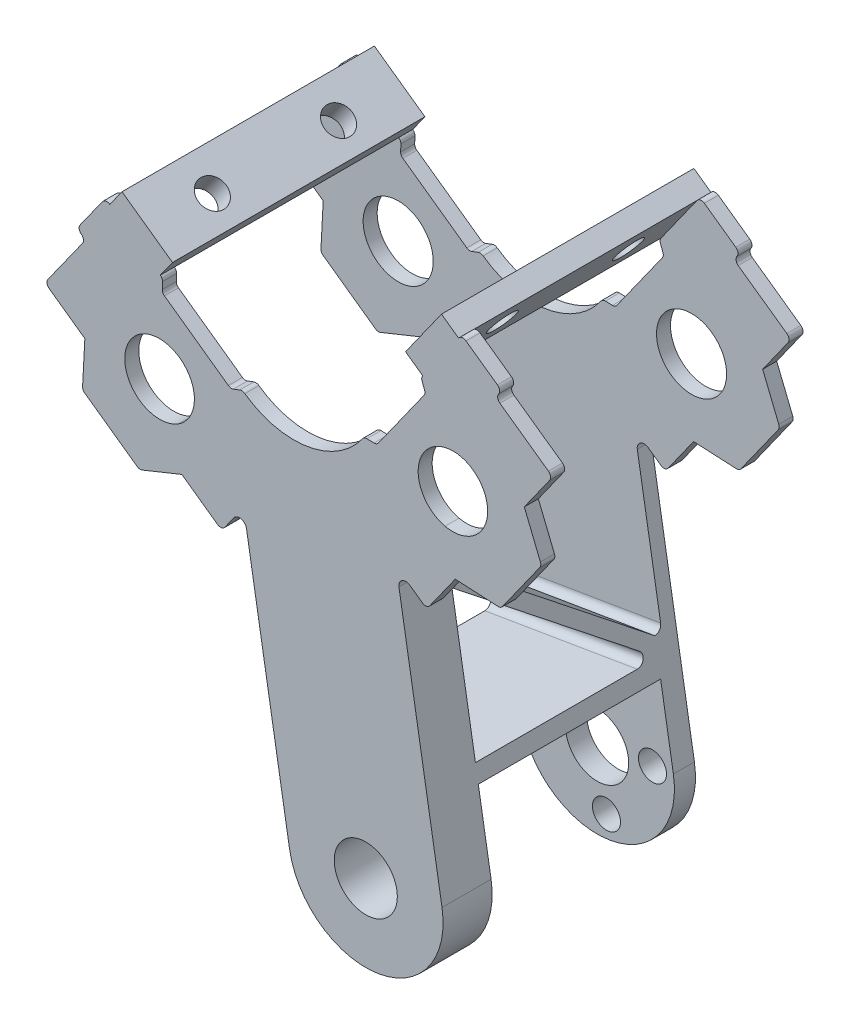
from build123d import *

# Parameters (mm, degrees)
SKETCH_2_R           = 73.899050909
EXTRUDE_2_DEPTH      = 3
SKETCH_6_OUTSIDE_W   = 191.606
SKETCH_6_OUTSIDE_H   = 191.606
CUT_EXTRUDE_4_DEPTH  = 10
SKETCH_7_R           = 4.5
SKETCH_7_R_2         = 2
CUT_EXTRUDE_5_DEPTH  = 10
SKETCH_8_R           = 5
CUT_EXTRUDE_6_DEPTH  = 10
SKETCH_9_W           = 6.25
SKETCH_9_H           = 33
SKETCH_9_R           = 2
EXTRUDE_3_DEPTH      = 20
SKETCH_10_W          = 6.25
SKETCH_10_H          = 30
CUT_EXTRUDE_7_DEPTH  = 17
SKETCH_11_W          = 1.5
SKETCH_11_H          = 33
SKETCH_11_W_2        = 1.098612182
EXTRUDE_4_DEPTH      = 3
SKETCH_13_R          = 2
SKETCH_13_R_2        = 4.5
SKETCH_13_R_3        = 5
EXTRUDE_7_DEPTH      = 3
EXTRUDE_8_DEPTH      = 4
SKETCH_19_W          = 26
SKETCH_19_H          = 2.5
EXTRUDE_10_DEPTH     = 22.051538
CUT_EXTRUDE_8_DEPTH  = 72.494882875
SKETCH_21_R          = 4.5
CUT_EXTRUDE_9_DEPTH  = 68.464062675
SKETCH_22_R          = 4.5
EXTRUDE_12_DEPTH     = 7
CUT_EXTRUDE_START    = -1
CUT_EXTRUDE_10_DEPTH = 1
CUT_EXTRUDE_11_DEPTH = 1
FILLET_1_R           = 1
FILLET_2_R           = 1
FILLET_3_R           = 1
FILLET_4_R           = 1
FILLET_5_R           = 1
FILLET_12_R          = 1


# Some blends are built 0.0001 mm under size
with BuildPart() as part:
    # 草图2 → 凸台-拉伸2 (new body)
    with BuildSketch(Plane.XY):
        Circle(SKETCH_2_R)
    extrude(amount=EXTRUDE_2_DEPTH)

    # 草图6 outside → 切除-拉伸4 (cut)
    with BuildSketch(Plane.XY.offset(3)):
        Rectangle(SKETCH_6_OUTSIDE_W, SKETCH_6_OUTSIDE_H)
        with BuildLine():
            Line((-31.535008434, 35.392907634), (-24.330725879, 30.255179498))
            ThreePointArc((-24.330725879, 30.255179498), (-24.094123176, 29.977447186), (-24.016566775, 29.6209348))
            Line((-24.016566775, 29.6209348), (-24.048055472, 28.621430692))
            ThreePointArc((-24.048055472, 28.621430692), (-23.970499071, 28.264918306), (-23.733896368, 27.987185994))
            Line((-23.733896368, 27.987185994), (-14.617442117, 21.485794197))
            ThreePointArc((-14.617442117, 21.485794197), (-14.277785331, 21.352567532), (-13.915454513, 21.395374713))
            Line((-13.915454513, 21.395374713), (-12.980724299, 21.750732881))
            ThreePointArc((-12.980724299, 21.750732881), (-12.618393481, 21.793540061), (-12.278736695, 21.660313397))
            ThreePointArc((-12.278736695, 21.660313397), (-3.294948021, 19.590594088), (4.517495731, 24.485276874))
            ThreePointArc((4.517495731, 24.485276874), (4.794882728, 24.722284322), (5.15128164, 24.800360515))
            Line((5.15128164, 24.800360515), (6.150830603, 24.770329354))
            ThreePointArc((6.150830603, 24.770329354), (6.507229515, 24.848405547), (6.784616512, 25.085412994))
            Line((6.784616512, 25.085412994), (13.272707556, 34.211338045))
            ThreePointArc((13.272707556, 34.211338045), (13.405438783, 34.551188744), (13.362103288, 34.913456755))
            Line((13.362103288, 34.913456755), (13.005382451, 35.847667782))
            ThreePointArc((13.005382451, 35.847667782), (12.962046956, 36.209935793), (13.094778183, 36.549786492))
            Line((13.094778183, 36.549786492), (18.221995392, 43.761553351))
            ThreePointArc((18.221995392, 43.761553351), (18.708323153, 44.066496264), (19.267836012, 43.938237808))
            Line((19.267836012, 43.938237808), (23.750427961, 40.751331876))
            ThreePointArc((23.750427961, 40.751331876), (24.055370874, 40.265004115), (23.927112418, 39.705491256))
            ThreePointArc((23.927112418, 39.705491256), (23.798853962, 39.145978396), (24.103796875, 38.659650636))
            Line((24.103796875, 38.659650636), (31.031438978, 33.734432377))
            ThreePointArc((31.031438978, 33.734432377), (31.336381891, 33.248104616), (31.208123435, 32.688591757))
            Line((31.208123435, 32.688591757), (27.586639421, 27.59473727))
            Line((27.586639421, 27.59473727), (29.886186599, 21.936685188))
            ThreePointArc((29.886186599, 21.936685188), (29.936337177, 21.567492307), (29.80264047, 21.219722765))
            Line((29.80264047, 21.219722765), (24.485385754, 13.740655704))
            ThreePointArc((24.485385754, 13.740655704), (24.200836556, 13.500134983), (23.835658301, 13.426220802))
            Line((23.835658301, 13.426220802), (17.736202905, 13.739453063))
            Line((17.736202905, 13.739453063), (14.114718892, 8.645598576))
            ThreePointArc((14.114718892, 8.645598576), (13.628391131, 8.340655663), (13.068878271, 8.468914119))
            Line((13.068878271, 8.468914119), (9.306333892, 11.143901076))
            Line((9.306333892, 11.143901076), (15.851133659, -27.769160612))
            ThreePointArc((15.851133659, -27.769160612), (6.806822505, -40.470956104), (-5.894972987, -31.42664495))
            Line((-5.894972987, -31.42664495), (-12.439772753, 7.486416738))
            Line((-12.439772753, 7.486416738), (-15.120243503, 3.727777092))
            ThreePointArc((-15.120243503, 3.727777092), (-15.607015422, 3.423543678), (-16.166340657, 3.552617894))
            Line((-16.166340657, 3.552617894), (-21.25490879, 7.181526042))
            Line((-21.25490879, 7.181526042), (-26.916308113, 4.890232022))
            ThreePointArc((-26.916308113, 4.890232022), (-27.285573732, 4.840619864), (-27.633147944, 4.974823555))
            Line((-27.633147944, 4.974823555), (-35.1044533, 10.30297878))
            ThreePointArc((-35.1044533, 10.30297878), (-35.344558829, 10.587878409), (-35.41794042, 10.953164059))
            Line((-35.41794042, 10.953164059), (-35.095814113, 17.052156207))
            Line((-35.095814113, 17.052156207), (-40.184382246, 20.681064356))
            ThreePointArc((-40.184382246, 20.681064356), (-40.48861566, 21.167836275), (-40.359541444, 21.727161509))
            Line((-40.359541444, 21.727161509), (-35.424226362, 28.647614171))
            ThreePointArc((-35.424226362, 28.647614171), (-35.295152147, 29.206939406), (-35.59938556, 29.693711325))
            ThreePointArc((-35.59938556, 29.693711325), (-35.903618974, 30.180483244), (-35.774544759, 30.739808479))
            Line((-35.774544759, 30.739808479), (-32.581105588, 35.217748436))
            ThreePointArc((-32.581105588, 35.217748436), (-32.094333668, 35.521981849), (-31.535008434, 35.392907634))
        make_face(mode=Mode.SUBTRACT)
    extrude(amount=-CUT_EXTRUDE_4_DEPTH, mode=Mode.SUBTRACT)

    # 草图7 → 切除-拉伸5 (cut)
    with BuildSketch(Plane.XY.offset(3)):
        with Locations((4.978080336, -29.597902781)):
            Circle(SKETCH_7_R)
        with Locations((3.651194467, -21.708709293)):
            Circle(SKETCH_7_R_2)
        with Locations((12.867273824, -28.271016911)):
            Circle(SKETCH_7_R_2)
        with Locations((6.304966206, -37.487096269)):
            Circle(SKETCH_7_R_2)
        with Locations((-2.911113152, -30.924788651)):
            Circle(SKETCH_7_R_2)
    extrude(amount=-CUT_EXTRUDE_5_DEPTH, mode=Mode.SUBTRACT)

    # 草图8 → 切除-拉伸6 (cut)
    with BuildSketch(Plane.XY.offset(3)):
        with Locations((-24.401296977, 17.408951983)):
            Circle(SKETCH_8_R)
        with Locations((17.442589177, 24.41531991)):
            Circle(SKETCH_8_R)
    extrude(amount=-CUT_EXTRUDE_6_DEPTH, mode=Mode.SUBTRACT)

    # 镜向3: part across plane


with BuildPart() as part_1:
    add(part.part)
    add(part.part.mirror(Plane(origin=(0, 0, 0), x_dir=(0, 0, 1), z_dir=(-0.9861491859840638, -0.16586073369839163, 0))))

    # 草图9 → 凸台-拉伸3 (add)
    with BuildSketch(Plane(origin=(-3.770666854, -5.287346609, 0), x_dir=(0.814170901346189, -0.5806253037899178, 0), z_dir=(-0.5806253037899178, -0.814170901346189, 0))):
        with Locations((-41.599903988, -13.5)):
            Rectangle(SKETCH_9_W, SKETCH_9_H)
        with Locations(Location((-41.452827346, -24, 0), (0, 0, 180))):
            Circle(SKETCH_9_R, mode=Mode.SUBTRACT)
        with Locations(Location((-41.452827346, -6, 0), (0, 0, 180))):
            Circle(SKETCH_9_R, mode=Mode.SUBTRACT)
    extrude(amount=-EXTRUDE_3_DEPTH)

    # 草图10 → 切除-拉伸7 (cut)
    with BuildSketch(Plane(origin=(-3.770666854, -5.287346609, 0), x_dir=(0.8141709013461893, -0.5806253037899172, 0), z_dir=(-0.5806253037899172, -0.8141709013461893, 0))):
        with Locations((-41.599903988, -15)):
            Rectangle(SKETCH_10_W, SKETCH_10_H)
    extrude(amount=-CUT_EXTRUDE_7_DEPTH, mode=Mode.SUBTRACT)

    # 草图11 → 凸台-拉伸4 (add)
    with BuildSketch(Plane(origin=(6.09996331, 8.553558714, 0), x_dir=(0.8141709013461892, -0.5806253037899176, 0), z_dir=(0.5806253037899175, 0.8141709013461891, 0))):
        with Locations((-45.474903988, 13.5)):
            Rectangle(SKETCH_11_W, SKETCH_11_H)
        with Locations((-37.925597897, 13.5)):
            Rectangle(SKETCH_11_W_2, SKETCH_11_H)
    extrude(amount=EXTRUDE_4_DEPTH)

    # 镜向4: part across plane


with BuildPart() as part_2:
    add(part_1.part)
    add(part_1.part.mirror(Plane(origin=(0, 0, 0), x_dir=(0, 0, 1), z_dir=(-0.9861491859840638, -0.16586073369839163, 0))))

    # 草图13 → 凸台-拉伸7 (add)
    # profile 1 of 3: a face of its own
    with BuildSketch(Plane(origin=(0, 0, -30), x_dir=(-1, 0, 0), z_dir=(0, 0, -1))):
        Polygon((-15.776945238, 45.499865677), (-18.221995392, 43.761553351), (-13.094778183, 36.549786492), (-10.649728029, 38.288098818), align=None)
    # profile 2 of 3: a face of its own
    with BuildSketch(Plane(origin=(0, 0, -30), x_dir=(-1, 0, 0), z_dir=(0, 0, -1))):
        with BuildLine():
            Line((-13.094778183, 36.549786492), (-18.221995392, 43.761553351))
            ThreePointArc((-18.221995392, 43.761553351), (-18.708323153, 44.066496264), (-19.267836012, 43.938237808))
            Line((-19.267836012, 43.938237808), (-23.750427961, 40.751331876))
            ThreePointArc((-23.750427961, 40.751331876), (-24.055370874, 40.265004115), (-23.927112418, 39.705491256))
            ThreePointArc((-23.927112418, 39.705491256), (-23.798853962, 39.145978396), (-24.103796875, 38.659650636))
            Line((-24.103796875, 38.659650636), (-31.031438978, 33.734432377))
            ThreePointArc((-31.031438978, 33.734432377), (-31.336381891, 33.248104616), (-31.208123435, 32.688591757))
            Line((-31.208123435, 32.688591757), (-27.586639421, 27.59473727))
            Line((-27.586639421, 27.59473727), (-29.886186599, 21.936685188))
            ThreePointArc((-29.886186599, 21.936685188), (-29.936337177, 21.567492307), (-29.80264047, 21.219722765))
            Line((-29.80264047, 21.219722765), (-24.485385754, 13.740655704))
            ThreePointArc((-24.485385754, 13.740655704), (-24.200836556, 13.500134983), (-23.835658301, 13.426220802))
            Line((-23.835658301, 13.426220802), (-17.736202905, 13.739453063))
            Line((-17.736202905, 13.739453063), (-14.114718892, 8.645598576))
            ThreePointArc((-14.114718892, 8.645598576), (-13.628391131, 8.340655663), (-13.068878271, 8.468914119))
            Line((-13.068878271, 8.468914119), (-9.306333892, 11.143901076))
            Line((-9.306333892, 11.143901076), (-15.851133659, -27.769160612))
            ThreePointArc((-15.851133659, -27.769160612), (-6.806822505, -40.470956104), (5.894972987, -31.42664495))
            Line((5.894972987, -31.42664495), (12.439772753, 7.486416738))
            Line((12.439772753, 7.486416738), (15.120243503, 3.727777092))
            ThreePointArc((15.120243503, 3.727777092), (15.607015422, 3.423543678), (16.166340657, 3.552617894))
            Line((16.166340657, 3.552617894), (21.25490879, 7.181526042))
            Line((21.25490879, 7.181526042), (26.916308113, 4.890232022))
            ThreePointArc((26.916308113, 4.890232022), (27.285573732, 4.840619864), (27.633147944, 4.974823555))
            Line((27.633147944, 4.974823555), (35.1044533, 10.30297878))
            ThreePointArc((35.1044533, 10.30297878), (35.344558829, 10.587878409), (35.41794042, 10.953164059))
            Line((35.41794042, 10.953164059), (35.095814113, 17.052156207))
            Line((35.095814113, 17.052156207), (40.184382246, 20.681064356))
            ThreePointArc((40.184382246, 20.681064356), (40.48861566, 21.167836275), (40.359541444, 21.727161509))
            Line((40.359541444, 21.727161509), (35.424226362, 28.647614171))
            ThreePointArc((35.424226362, 28.647614171), (35.295152147, 29.206939406), (35.59938556, 29.693711325))
            ThreePointArc((35.59938556, 29.693711325), (35.903618974, 30.180483244), (35.774544759, 30.739808479))
            Line((35.774544759, 30.739808479), (32.581105588, 35.217748436))
            ThreePointArc((32.581105588, 35.217748436), (32.094333668, 35.521981849), (31.535008434, 35.392907634))
            Line((31.535008434, 35.392907634), (24.330725879, 30.255179498))
            ThreePointArc((24.330725879, 30.255179498), (24.094123176, 29.977447186), (24.016566775, 29.6209348))
            Line((24.016566775, 29.6209348), (24.048055472, 28.621430692))
            ThreePointArc((24.048055472, 28.621430692), (23.970499071, 28.264918306), (23.733896368, 27.987185994))
            Line((23.733896368, 27.987185994), (14.617442117, 21.485794197))
            ThreePointArc((14.617442117, 21.485794197), (14.277785331, 21.352567532), (13.915454513, 21.395374713))
            Line((13.915454513, 21.395374713), (12.980724299, 21.750732881))
            ThreePointArc((12.980724299, 21.750732881), (12.618393481, 21.793540061), (12.278736695, 21.660313397))
            ThreePointArc((12.278736695, 21.660313397), (3.294948021, 19.590594088), (-4.517495731, 24.485276874))
            ThreePointArc((-4.517495731, 24.485276874), (-4.794882728, 24.722284322), (-5.15128164, 24.800360515))
            Line((-5.15128164, 24.800360515), (-6.150830603, 24.770329354))
            ThreePointArc((-6.150830603, 24.770329354), (-6.507229515, 24.848405547), (-6.784616512, 25.085412994))
            Line((-6.784616512, 25.085412994), (-13.272707556, 34.211338045))
            ThreePointArc((-13.272707556, 34.211338045), (-13.405438783, 34.551188744), (-13.362103288, 34.913456755))
            Line((-13.362103288, 34.913456755), (-13.005382451, 35.847667782))
            ThreePointArc((-13.005382451, 35.847667782), (-12.962046956, 36.209935793), (-13.094778183, 36.549786492))
        make_face()
        with Locations(Location((-6.304966206, -37.487096269, 0), (0, 0, 180))):
            Circle(SKETCH_13_R, mode=Mode.SUBTRACT)
        with Locations(Location((2.911113152, -30.924788651, 0), (0, 0, 180))):
            Circle(SKETCH_13_R, mode=Mode.SUBTRACT)
        with Locations(Location((-12.867273824, -28.271016911, 0), (0, 0, 180))):
            Circle(SKETCH_13_R, mode=Mode.SUBTRACT)
        with Locations(Location((-4.978080336, -29.597902781, 0), (0, 0, 180))):
            Circle(SKETCH_13_R_2, mode=Mode.SUBTRACT)
        with Locations(Location((-3.651194467, -21.708709293, 0), (0, 0, 180))):
            Circle(SKETCH_13_R, mode=Mode.SUBTRACT)
        with Locations((-17.442589177, 24.41531991)):
            Circle(SKETCH_13_R_3, mode=Mode.SUBTRACT)
        with Locations((24.401296977, 17.408951983)):
            Circle(SKETCH_13_R_3, mode=Mode.SUBTRACT)
    # profile 3 of 3: a face of its own
    with BuildSketch(Plane(origin=(0, 0, -30), x_dir=(-1, 0, 0), z_dir=(0, 0, -1))):
        Polygon((22.588849967, 32.697692202), (24.330725879, 30.255179498), (31.535008434, 35.392907634), (29.793132522, 37.835420338), align=None)
    extrude(amount=EXTRUDE_7_DEPTH)

    # 草图15 → 凸台-拉伸8 (add)
    with BuildSketch(Plane(origin=(0, 0, 0), x_dir=(-1, 0, 0), z_dir=(0, 0, -1))):
        with BuildLine():
            Line((-9.306333892, 11.143901076), (-15.851133659, -27.769160612))
            ThreePointArc((-15.851133659, -27.769160612), (-6.806822505, -40.470956104), (5.894972987, -31.42664495))
            Line((5.894972987, -31.42664495), (12.439772753, 7.486416738))
            Line((12.439772753, 7.486416738), (-9.306333892, 11.143901076))
        make_face()
    extrude(amount=EXTRUDE_8_DEPTH)

    # 草图19 → 凸台-拉伸10 (add)
    with BuildSketch(Plane(origin=(-10.873053323, -1.828742169, 0), x_dir=(0, 0, 1), z_dir=(-0.9861491859840638, -0.16586073369839163, 0))):
        Polygon((-30, -14.039384993), (-30, -16.539384993), (-4, 3.661315578), (-4, 6.161315578), align=None)
        with Locations((-17, -17.789384993)):
            Rectangle(SKETCH_19_W, SKETCH_19_H)
    extrude(amount=-EXTRUDE_10_DEPTH)

    # 草图20 → 切除-拉伸8 (cut, through all)
    with BuildSketch(Plane(origin=(-10.873053323, -1.828742169, 0), x_dir=(0, 0, 1), z_dir=(-0.9861491859840638, -0.16586073369839163, 0))):
        Polygon((-4, 6.161315578), (0, 9.445993608), (-4, 9.445993608), align=None)
    extrude(amount=-CUT_EXTRUDE_8_DEPTH, mode=Mode.SUBTRACT)

    # 草图21 → 切除-拉伸9 (cut, through all)
    with BuildSketch(Plane(origin=(0, 0, -4), x_dir=(-1, 0, 0), z_dir=(0, 0, -1))):
        with Locations(Location((-4.978080336, -29.597902781, 0), (0, 0, 180))):
            Circle(SKETCH_21_R)
    extrude(amount=-CUT_EXTRUDE_9_DEPTH, mode=Mode.SUBTRACT)

    # 草图22 → 凸台-拉伸12 (add, through all)
    with BuildSketch(Plane(origin=(0, 0, -4), x_dir=(-1, 0, 0), z_dir=(0, 0, -1))):
        with BuildLine():
            Line((-14.030939687, -16.946931843), (-15.851133659, -27.769160612))
            ThreePointArc((-15.851133659, -27.769160612), (-6.806822505, -40.470956104), (5.894972987, -31.42664495))
            Line((5.894972987, -31.42664495), (7.715166959, -20.604416181))
            Line((7.715166959, -20.604416181), (-14.030939687, -16.946931843))
        make_face()
        with Locations(Location((-4.978080336, -29.597902781, 0), (0, 0, 180))):
            Circle(SKETCH_22_R, mode=Mode.SUBTRACT)
    extrude(amount=-EXTRUDE_12_DEPTH)

    # 草图23 → 切除-拉伸10 (cut)
    with BuildSketch(Plane(origin=(0, 0, 0), x_dir=(-1, 0, 0), z_dir=(0, 0, -1)).offset(CUT_EXTRUDE_START)):
        with BuildLine():
            Line((-23.835658301, 13.426220802), (-17.736202905, 13.739453063))
            Line((-17.736202905, 13.739453063), (-14.114718892, 8.645598576))
            ThreePointArc((-14.114718892, 8.645598576), (-13.628391131, 8.340655663), (-13.068878271, 8.468914119))
            Line((-13.068878271, 8.468914119), (-9.306333892, 11.143901076))
            Line((-9.306333892, 11.143901076), (12.439772753, 7.486416738))
            Line((12.439772753, 7.486416738), (15.120243503, 3.727777092))
            ThreePointArc((15.120243503, 3.727777092), (15.607015422, 3.423543678), (16.166340657, 3.552617894))
            Line((16.166340657, 3.552617894), (21.25490879, 7.181526042))
            Line((21.25490879, 7.181526042), (26.916308113, 4.890232022))
            ThreePointArc((26.916308113, 4.890232022), (27.285573732, 4.840619864), (27.633147944, 4.974823555))
            Line((27.633147944, 4.974823555), (35.1044533, 10.30297878))
            ThreePointArc((35.1044533, 10.30297878), (35.344558829, 10.587878409), (35.41794042, 10.953164059))
            Line((35.41794042, 10.953164059), (35.095814113, 17.052156207))
            Line((35.095814113, 17.052156207), (40.184382246, 20.681064356))
            ThreePointArc((40.184382246, 20.681064356), (40.48861566, 21.167836275), (40.359541444, 21.727161509))
            Line((40.359541444, 21.727161509), (35.424226362, 28.647614171))
            ThreePointArc((35.424226362, 28.647614171), (35.295152147, 29.206939406), (35.59938556, 29.693711325))
            ThreePointArc((35.59938556, 29.693711325), (35.903618974, 30.180483244), (35.774544759, 30.739808479))
            Line((35.774544759, 30.739808479), (32.581105588, 35.217748436))
            ThreePointArc((32.581105588, 35.217748436), (32.094333668, 35.521981849), (31.535008434, 35.392907634))
            Line((31.535008434, 35.392907634), (24.330725879, 30.255179498))
            ThreePointArc((24.330725879, 30.255179498), (24.094123176, 29.977447186), (24.016566775, 29.6209348))
            Line((24.016566775, 29.6209348), (24.048055472, 28.621430692))
            ThreePointArc((24.048055472, 28.621430692), (23.970499071, 28.264918306), (23.733896368, 27.987185994))
            Line((23.733896368, 27.987185994), (14.617442117, 21.485794197))
            ThreePointArc((14.617442117, 21.485794197), (14.277785331, 21.352567532), (13.915454513, 21.395374713))
            Line((13.915454513, 21.395374713), (12.980724299, 21.750732881))
            ThreePointArc((12.980724299, 21.750732881), (12.618393481, 21.793540061), (12.278736695, 21.660313397))
            ThreePointArc((12.278736695, 21.660313397), (3.294948021, 19.590594088), (-4.517495731, 24.485276874))
            ThreePointArc((-4.517495731, 24.485276874), (-4.794882728, 24.722284322), (-5.15128164, 24.800360515))
            Line((-5.15128164, 24.800360515), (-6.150830603, 24.770329354))
            ThreePointArc((-6.150830603, 24.770329354), (-6.507229515, 24.848405547), (-6.784616512, 25.085412994))
            Line((-6.784616512, 25.085412994), (-13.272707556, 34.211338045))
            ThreePointArc((-13.272707556, 34.211338045), (-13.405438783, 34.551188744), (-13.362103288, 34.913456755))
            Line((-13.362103288, 34.913456755), (-13.005382451, 35.847667782))
            ThreePointArc((-13.005382451, 35.847667782), (-12.962046956, 36.209935793), (-13.094778183, 36.549786492))
            Line((-13.094778183, 36.549786492), (-18.221995392, 43.761553351))
            ThreePointArc((-18.221995392, 43.761553351), (-18.708323153, 44.066496264), (-19.267836012, 43.938237808))
            Line((-19.267836012, 43.938237808), (-23.750427961, 40.751331876))
            ThreePointArc((-23.750427961, 40.751331876), (-24.055370874, 40.265004115), (-23.927112418, 39.705491256))
            ThreePointArc((-23.927112418, 39.705491256), (-23.798853962, 39.145978396), (-24.103796875, 38.659650636))
            Line((-24.103796875, 38.659650636), (-31.031438978, 33.734432377))
            ThreePointArc((-31.031438978, 33.734432377), (-31.336381891, 33.248104616), (-31.208123435, 32.688591757))
            Line((-31.208123435, 32.688591757), (-27.586639421, 27.59473727))
            Line((-27.586639421, 27.59473727), (-29.886186599, 21.936685188))
            ThreePointArc((-29.886186599, 21.936685188), (-29.936337177, 21.567492307), (-29.80264047, 21.219722765))
            Line((-29.80264047, 21.219722765), (-24.485385754, 13.740655704))
            ThreePointArc((-24.485385754, 13.740655704), (-24.200836556, 13.500134983), (-23.835658301, 13.426220802))
        make_face()
    extrude(amount=CUT_EXTRUDE_10_DEPTH, mode=Mode.SUBTRACT)

    # 草图24 → 切除-拉伸11 (cut)
    with BuildSketch(Plane.XY.offset(-30)):
        with BuildLine():
            Line((-8.544470627, -15.673670252), (13.201636018, -12.016185913))
            Line((13.201636018, -12.016185913), (9.306333892, 11.143901076))
            Line((9.306333892, 11.143901076), (13.068878271, 8.468914119))
            ThreePointArc((13.068878271, 8.468914119), (13.628391131, 8.340655663), (14.114718892, 8.645598576))
            Line((14.114718892, 8.645598576), (17.736202905, 13.739453063))
            Line((17.736202905, 13.739453063), (23.835658301, 13.426220802))
            ThreePointArc((23.835658301, 13.426220802), (24.200836556, 13.500134983), (24.485385754, 13.740655704))
            Line((24.485385754, 13.740655704), (29.80264047, 21.219722765))
            ThreePointArc((29.80264047, 21.219722765), (29.936337177, 21.567492307), (29.886186599, 21.936685188))
            Line((29.886186599, 21.936685188), (27.586639421, 27.59473727))
            Line((27.586639421, 27.59473727), (31.208123435, 32.688591757))
            ThreePointArc((31.208123435, 32.688591757), (31.336381891, 33.248104616), (31.031438978, 33.734432377))
            Line((31.031438978, 33.734432377), (24.103796875, 38.659650636))
            ThreePointArc((24.103796875, 38.659650636), (23.798853962, 39.145978396), (23.927112418, 39.705491256))
            ThreePointArc((23.927112418, 39.705491256), (24.055370874, 40.265004115), (23.750427961, 40.751331876))
            Line((23.750427961, 40.751331876), (19.267836012, 43.938237808))
            ThreePointArc((19.267836012, 43.938237808), (18.708323153, 44.066496264), (18.221995392, 43.761553351))
            Line((18.221995392, 43.761553351), (13.094778183, 36.549786492))
            ThreePointArc((13.094778183, 36.549786492), (12.962046956, 36.209935793), (13.005382451, 35.847667782))
            Line((13.005382451, 35.847667782), (13.362103288, 34.913456755))
            ThreePointArc((13.362103288, 34.913456755), (13.405438783, 34.551188744), (13.272707556, 34.211338045))
            Line((13.272707556, 34.211338045), (6.784616512, 25.085412994))
            ThreePointArc((6.784616512, 25.085412994), (6.507229515, 24.848405547), (6.150830603, 24.770329354))
            Line((6.150830603, 24.770329354), (5.15128164, 24.800360515))
            ThreePointArc((5.15128164, 24.800360515), (4.794882728, 24.722284322), (4.517495731, 24.485276874))
            ThreePointArc((4.517495731, 24.485276874), (-3.294948021, 19.590594088), (-12.278736695, 21.660313397))
            ThreePointArc((-12.278736695, 21.660313397), (-12.618393481, 21.793540061), (-12.980724299, 21.750732881))
            Line((-12.980724299, 21.750732881), (-13.915454513, 21.395374713))
            ThreePointArc((-13.915454513, 21.395374713), (-14.277785331, 21.352567532), (-14.617442117, 21.485794197))
            Line((-14.617442117, 21.485794197), (-23.733896368, 27.987185994))
            ThreePointArc((-23.733896368, 27.987185994), (-23.970499071, 28.264918306), (-24.048055472, 28.621430692))
            Line((-24.048055472, 28.621430692), (-24.016566775, 29.6209348))
            ThreePointArc((-24.016566775, 29.6209348), (-24.094123176, 29.977447186), (-24.330725879, 30.255179498))
            Line((-24.330725879, 30.255179498), (-31.535008434, 35.392907634))
            ThreePointArc((-31.535008434, 35.392907634), (-32.094333668, 35.521981849), (-32.581105588, 35.217748436))
            Line((-32.581105588, 35.217748436), (-35.774544759, 30.739808479))
            ThreePointArc((-35.774544759, 30.739808479), (-35.903618974, 30.180483244), (-35.59938556, 29.693711325))
            ThreePointArc((-35.59938556, 29.693711325), (-35.295152147, 29.206939406), (-35.424226362, 28.647614171))
            Line((-35.424226362, 28.647614171), (-40.359541444, 21.727161509))
            ThreePointArc((-40.359541444, 21.727161509), (-40.48861566, 21.167836275), (-40.184382246, 20.681064356))
            Line((-40.184382246, 20.681064356), (-35.095814113, 17.052156207))
            Line((-35.095814113, 17.052156207), (-35.41794042, 10.953164059))
            ThreePointArc((-35.41794042, 10.953164059), (-35.344558829, 10.587878409), (-35.1044533, 10.30297878))
            Line((-35.1044533, 10.30297878), (-27.633147944, 4.974823555))
            ThreePointArc((-27.633147944, 4.974823555), (-27.285573732, 4.840619864), (-26.916308113, 4.890232022))
            Line((-26.916308113, 4.890232022), (-21.25490879, 7.181526042))
            Line((-21.25490879, 7.181526042), (-16.166340657, 3.552617894))
            ThreePointArc((-16.166340657, 3.552617894), (-15.607015422, 3.423543678), (-15.120243503, 3.727777092))
            Line((-15.120243503, 3.727777092), (-12.439772753, 7.486416738))
            Line((-12.439772753, 7.486416738), (-8.544470627, -15.673670252))
        make_face()
    extrude(amount=-CUT_EXTRUDE_11_DEPTH, mode=Mode.SUBTRACT)

    # 圆角1
    fillet_1_edges = [part_2.edges().sort_by_distance(p)[0] for p in [
        (2.328582696, -13.844928082, -31),
    ]]
    fillet(fillet_1_edges, radius=FILLET_1_R - 0.0001)  # a hair under: the kernel refuses the full size

    # 圆角2
    # the kernel refuses this fillet: 1 mm, written as the material it adds along each edge
    with BuildSketch(Plane(origin=(-8.129818793, -18.139043217, -30), x_dir=(0, 0, 1), z_dir=(0.9861491859840636, 0.1658607336983916, 0))) as fillet_2_piece_1:
        with BuildLine():
            CenterArc((FILLET_2_R * 2.91698757328, -FILLET_2_R), FILLET_2_R, 90, 142.154578822)
            Line((FILLET_2_R * 2.30345431759, -FILLET_2_R * 1.78966888262), (0, 0))
            Line((0, 0), (FILLET_2_R * 2.91698757328, 0))
        make_face()
    extrude(amount=22.051538)

    # 圆角3
    fillet_3_edges = [part_2.edges().sort_by_distance(p)[0] for p in [
        (9.306333892, 11.143901076, -32),
    ]]
    fillet(fillet_3_edges, radius=FILLET_3_R)

    # 圆角4
    fillet_4_edges = [part_2.edges().sort_by_distance(p)[0] for p in [
        (-12.439772753, 7.486416738, -32),
    ]]
    fillet(fillet_4_edges, radius=FILLET_4_R)

    # 圆角5
    fillet_5_edges = [part_2.edges().sort_by_distance(p)[0] for p in [
        (-12.439772753, 7.486416738, 2),
    ]]
    fillet(fillet_5_edges, radius=FILLET_5_R)

    # 圆角11
    # a fillet whose section is not a circle: 2.75 mm, written as the material it takes off along each edge
    with BuildSketch(Plane(origin=(-14.866736318, 7.078224992, 0), x_dir=(0, 0, 1), z_dir=(0.9861491859840636, 0.16586073369839163, 0))) as fillet_11_piece_1:
        with BuildLine():
            add(Edge.make_bspline([(0.984420451, 0), (0.803178894, 0), (0.621937337, 0), (0.217809964, 0.029325048), (-0.149718607, 0.160889645), (-0.480648377, 0.394693791), (-0.620716283, 0.509713284), (-0.760784188, 0.624732777)], knots=[0, 0, 0, 0, 0, 0, 0.5, 0.5, 1, 1, 1, 1, 1, 1], degree=5))
            Line((-0.760784188, 0.624732777), (0, 0))
            Line((0, 0), (0.984420451, 0))
        make_face()
    extrude(amount=26.973640656, mode=Mode.SUBTRACT)

    # 圆角12
    fillet_12_edges = [part_2.edges().sort_by_distance(p)[0] for p in [
        (9.306333892, 11.143901076, 2),
    ]]
    fillet(fillet_12_edges, radius=FILLET_12_R)


solid = part_2.part
